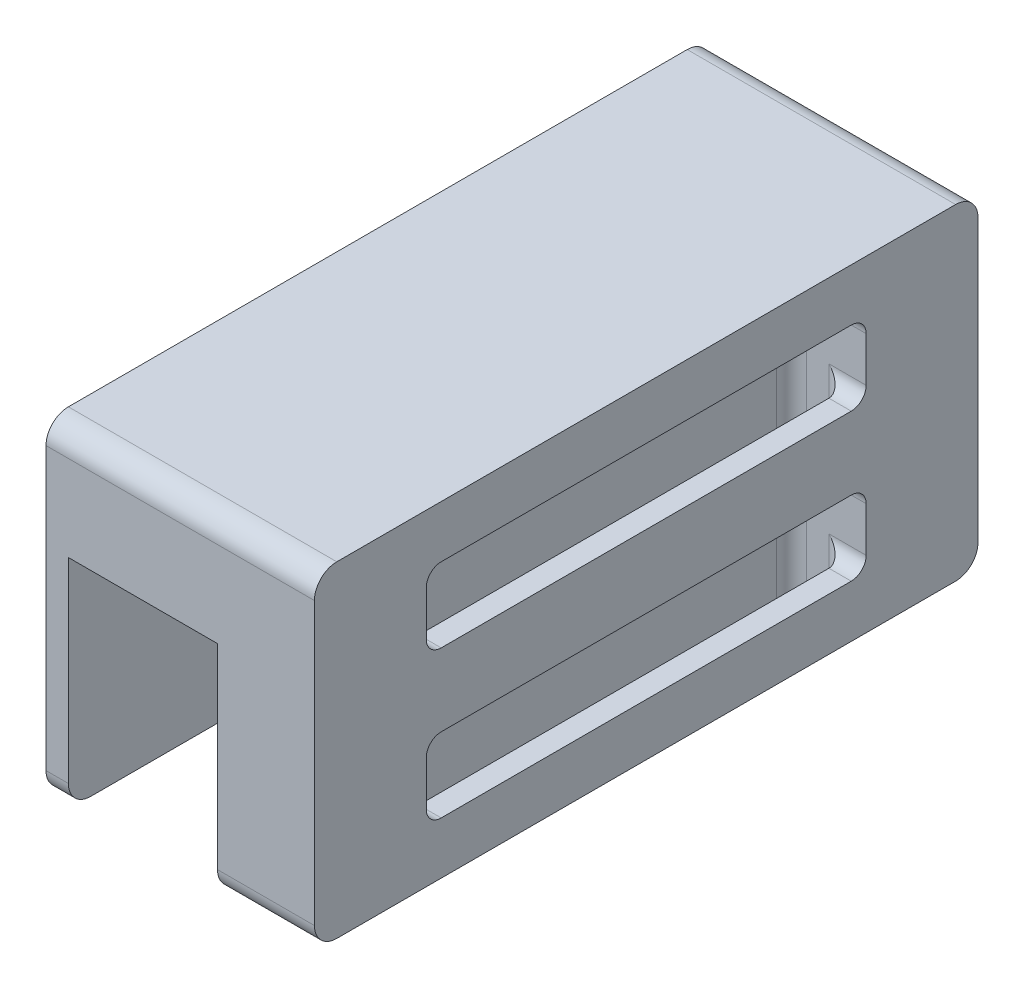
from build123d import *

# Parameters (mm, degrees)
RESSALTO_EXTRUS_O2_DEPTH      = 30
RESSALTO_EXTRUS_O3_START      = 3
RESSALTO_EXTRUS_O3_DEPTH      = 3
RESSALTO_EXTRUS_O4_DEPTH      = 3
RESSALTO_EXTRUS_O4_DEPTH_BACK = 10
CORTE_EXTRUS_O1_DEPTH         = 10
CORTE_EXTRUS_O2_REACH         = 83.702
FILETE1_START                 = -19.773073923
FILETE1_DEPTH                 = 36.75
FILETE1_START_2               = -13.40159992
FILETE1_2_DEPTH               = 59


with BuildPart() as part:
    # Esboço2 → Ressalto-extrusão2 (new body)
    with BuildSketch(Plane(origin=(0, 0, 0), x_dir=(0, 0, -1), z_dir=(1, 0, 0))):
        with BuildLine():
            Line((2.90159992, -0.062465938), (-35.09840008, -0.062465938))
            Line((-35.09840008, -0.062465938), (-39.886084903, -0.062465938))
            ThreePointArc((-39.886084903, -0.062465938), (-45.202180234, 1.467638524), (-48.891439328, 5.589707975))
            ThreePointArc((-48.891439328, 5.589707975), (-52.096536948, 9.772081499), (-56.69840008, 12.338743681))
            ThreePointArc((-56.69840008, 12.338743681), (-59.373224015, 11.895603401), (-60.59840008, 9.476926077))
            Line((-60.59840008, 9.476926077), (-60.59840008, 20.976926077))
            ThreePointArc((-60.59840008, 20.976926077), (-59.719720424, 23.09824642), (-57.59840008, 23.976926077))
            Line((-57.59840008, 23.976926077), (25.40159992, 23.976926077))
            ThreePointArc((25.40159992, 23.976926077), (27.522920263, 23.09824642), (28.40159992, 20.976926077))
            Line((28.40159992, 20.976926077), (28.40159992, 9.476926077))
            ThreePointArc((28.40159992, 9.476926077), (27.176423855, 11.895603401), (24.50159992, 12.338743681))
            ThreePointArc((24.50159992, 12.338743681), (19.899736788, 9.772081499), (16.694639168, 5.589707975))
            ThreePointArc((16.694639168, 5.589707975), (13.005380073, 1.467638524), (7.689284743, -0.062465938))
            Line((7.689284743, -0.062465938), (2.90159992, -0.062465938))
        make_face()
    extrude(amount=RESSALTO_EXTRUS_O2_DEPTH)

    # Esboço3 → Ressalto-extrusão3 (add)
    with BuildSketch(Plane.ZY.offset(RESSALTO_EXTRUS_O3_START)):
        with BuildLine():
            Line((60.59840008, 15.226926077), (60.59840008, 20.976926077))
            ThreePointArc((60.59840008, 20.976926077), (59.719720424, 23.09824642), (57.59840008, 23.976926077))
            Line((57.59840008, 23.976926077), (16.09840008, 23.976926077))
            Line((16.09840008, 23.976926077), (-25.40159992, 23.976926077))
            ThreePointArc((-25.40159992, 23.976926077), (-27.522920263, 23.09824642), (-28.40159992, 20.976926077))
            Line((-28.40159992, 20.976926077), (-28.40159992, 15.226926077))
            Line((-28.40159992, 15.226926077), (-28.40159992, -16.773073923))
            ThreePointArc((-28.40159992, -16.773073923), (-27.522920263, -18.894394267), (-25.40159992, -19.773073923))
            Line((-25.40159992, -19.773073923), (57.59840008, -19.773073923))
            ThreePointArc((57.59840008, -19.773073923), (59.719720424, -18.894394267), (60.59840008, -16.773073923))
            Line((60.59840008, -16.773073923), (60.59840008, 15.226926077))
        make_face()
    extrude(amount=-RESSALTO_EXTRUS_O3_DEPTH)

    # Esboço4 → Ressalto-extrusão4 (add, two sides: drawn at the far end of the back side and taken through both)
    with BuildSketch(Plane(origin=(30, 0, 0), x_dir=(0, 0, -1), z_dir=(1, 0, 0)).offset(-RESSALTO_EXTRUS_O4_DEPTH_BACK)):
        with BuildLine():
            Line((-16.09840008, 23.976926077), (25.40159992, 23.976926077))
            ThreePointArc((25.40159992, 23.976926077), (27.522920263, 23.09824642), (28.40159992, 20.976926077))
            Line((28.40159992, 20.976926077), (28.40159992, 15.226926077))
            Line((28.40159992, 15.226926077), (28.40159992, -16.773073923))
            ThreePointArc((28.40159992, -16.773073923), (27.522920263, -18.894394267), (25.40159992, -19.773073923))
            Line((25.40159992, -19.773073923), (-57.59840008, -19.773073923))
            ThreePointArc((-57.59840008, -19.773073923), (-59.719720424, -18.894394267), (-60.59840008, -16.773073923))
            Line((-60.59840008, -16.773073923), (-60.59840008, 15.226926077))
            Line((-60.59840008, 15.226926077), (-60.59840008, 20.976926077))
            ThreePointArc((-60.59840008, 20.976926077), (-59.719720424, 23.09824642), (-57.59840008, 23.976926077))
            Line((-57.59840008, 23.976926077), (-16.09840008, 23.976926077))
        make_face()
    extrude(amount=RESSALTO_EXTRUS_O4_DEPTH + RESSALTO_EXTRUS_O4_DEPTH_BACK)

    # Esboço8 → Corte-extrusão1 (cut)
    with BuildSketch(Plane(origin=(33, 0, 0), x_dir=(0, 0, -1), z_dir=(1, 0, 0))):
        with BuildLine():
            Line((-43.59840008, -2.773073923), (11.40159992, -2.773073923))
            ThreePointArc((11.40159992, -2.773073923), (12.815813482, -3.358860361), (13.40159992, -4.773073923))
            Line((13.40159992, -4.773073923), (13.40159992, -10.773073923))
            ThreePointArc((13.40159992, -10.773073923), (12.815813482, -12.187287486), (11.40159992, -12.773073923))
            Line((11.40159992, -12.773073923), (-43.59840008, -12.773073923))
            ThreePointArc((-43.59840008, -12.773073923), (-45.012613643, -12.187287486), (-45.59840008, -10.773073923))
            Line((-45.59840008, -10.773073923), (-45.59840008, -4.773073923))
            ThreePointArc((-45.59840008, -4.773073923), (-45.012613643, -3.358860361), (-43.59840008, -2.773073923))
        make_face()
        with BuildLine():
            Line((-43.59840008, 6.976926077), (11.40159992, 6.976926077))
            ThreePointArc((11.40159992, 6.976926077), (12.815813482, 7.562712514), (13.40159992, 8.976926077))
            Line((13.40159992, 8.976926077), (13.40159992, 14.976926077))
            ThreePointArc((13.40159992, 14.976926077), (12.815813482, 16.391139639), (11.40159992, 16.976926077))
            Line((11.40159992, 16.976926077), (-43.59840008, 16.976926077))
            ThreePointArc((-43.59840008, 16.976926077), (-45.012613643, 16.391139639), (-45.59840008, 14.976926077))
            Line((-45.59840008, 14.976926077), (-45.59840008, 8.976926077))
            ThreePointArc((-45.59840008, 8.976926077), (-45.012613643, 7.562712514), (-43.59840008, 6.976926077))
        make_face()
    extrude(amount=-CORTE_EXTRUS_O1_DEPTH, mode=Mode.SUBTRACT)

    # Corte-extrusão2: up to this face of the body (flat: up to its plane)
    corte_extrus_o2_end = Plane(part.part.faces().sort_by_distance((28, 16.976926077, 16.09840008))[0])
    # Esboço9 → Corte-extrusão2 (cut, up to the picked face)
    with BuildSketch(Plane(origin=(0, -19.773073923, 0), x_dir=(-1, 0, 0), z_dir=(0, -1, 0)), mode=Mode.PRIVATE) as corte_extrus_o2_sk1:
        with BuildLine():
            Line((-25, 13.40159992), (-28, 13.40159992))
            ThreePointArc((-28, 13.40159992), (-29.414213562, 12.815813482), (-30, 11.40159992))
            Line((-30, 11.40159992), (-30, -43.59840008))
            ThreePointArc((-30, -43.59840008), (-29.414213562, -45.012613643), (-28, -45.59840008))
            Line((-28, -45.59840008), (-25, -45.59840008))
            ThreePointArc((-25, -45.59840008), (-23.585786438, -45.012613643), (-23, -43.59840008))
            Line((-23, -43.59840008), (-23, 11.40159992))
            ThreePointArc((-23, 11.40159992), (-23.585786438, 12.815813482), (-25, 13.40159992))
        make_face()
    corte_extrus_o2_tool1 = split(extrude(corte_extrus_o2_sk1.sketch, amount=-CORTE_EXTRUS_O2_REACH, mode=Mode.PRIVATE), bisect_by=corte_extrus_o2_end, keep=Keep.BOTH, mode=Mode.PRIVATE)
    add(corte_extrus_o2_tool1.solids().sort_by(Axis((26.5, -19.773074, 16.0984), (0, 1, 0)))[0], mode=Mode.SUBTRACT)

    # Filete1: read off the stored shape, not the designer's step
    # Filete1 outline → Filete1 (add)
    with BuildSketch(Plane(origin=(0, 0, 0), x_dir=(1, 0, 0), z_dir=(0, 1, 0)).offset(FILETE1_START)):
        with BuildLine():
            ThreePointArc((25, -45.59840008), (23.585786437, -45.012613642), (23, -43.59840008))
            Line((23, -43.59840008), (23, -45.59840008))
            Line((23, -45.59840008), (25, -45.59840008))
        make_face()
        with BuildLine():
            ThreePointArc((23, 11.40159992), (23.585786438, 12.815813482), (25, 13.40159992))
            Line((25, 13.40159992), (23, 13.40159992))
            Line((23, 13.40159992), (23, 11.40159992))
        make_face()
    extrude(amount=FILETE1_DEPTH)

    # Filete1 2 outline → Filete1 2 (add)
    with BuildSketch(Plane.XY.offset(FILETE1_START_2)):
        with BuildLine():
            ThreePointArc((23, 14.976926077), (23.585786438, 16.391139639), (25, 16.976926077))
            Line((25, 16.976926077), (23, 16.976926077))
            Line((23, 16.976926077), (23, 14.976926077))
        make_face()
    extrude(amount=FILETE1_2_DEPTH)


solid = part.part
